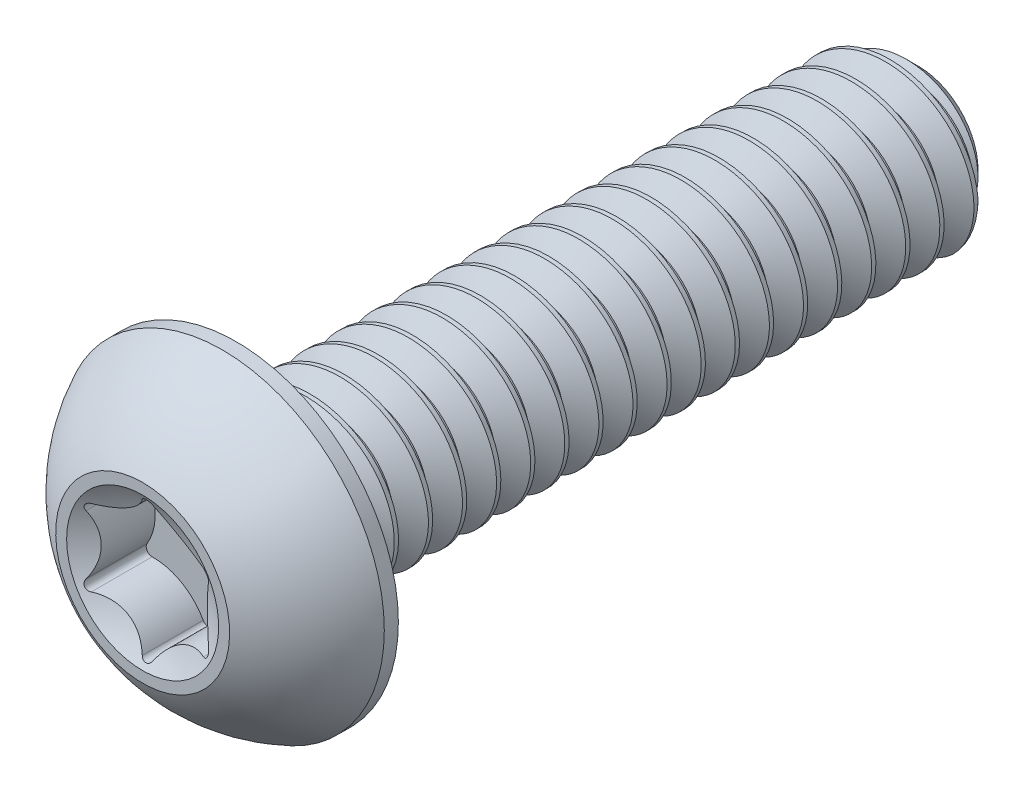
from build123d import *
from build123d.topology import SkipClean

# Parameters (mm, degrees)
CUT_EXTRUDE1_DEPTH = 0.77
CIRPATTERN1_COUNT  = 6
CUT_SWEEP1_PITCH   = 0.4
CUT_SWEEP1_TO      = 8


with BuildPart() as part:
    # Sketch2 → Revolve1 (revolve)
    with BuildSketch(Plane(origin=(0, 0, 0), x_dir=(0, 0, -1), z_dir=(1, 0, 0))):
        Polygon((1.1, 1), (8.8, 1), (9.1, 0.7), (9.1, 0), (1.1, 0), align=None)
    revolve(axis=Axis((0, 0, -9.1), (0, 0, 1)))


with BuildPart() as body_2:
    # Sketch3 → Revolve2 (revolve)
    with BuildSketch(Plane(origin=(0, 0, 0), x_dir=(0, 0, -1), z_dir=(1, 0, 0)), mode=Mode.PRIVATE) as revolve2_sk:
        with BuildLine():
            Line((1.1, 0), (1.1, 1.9))
            Line((1.1, 1.9), (0.935, 1.9))
            ThreePointArc((0.935, 1.9), (0.398804, 1.533165), (0, 1.0203))
            Line((0, 1.0203), (0, 0))
            Line((0, 0), (1.1, 0))
        make_face()
    revolve(revolve2_sk.sketch.rotate(Axis((0, 0, 0), (0, 0, -1)), 90), axis=Axis((0, 0, 0), (0, 0, -1)))

    # Combine1: union part
    add(part.part)

    # Sketch4 → Cut-Extrude1 (cut)
    with BuildSketch(Plane.XY):
        with BuildLine():
            Line((0, 0), (-0.719061, 0.41515))
            ThreePointArc((-0.719061, 0.41515), (-0.728207, 0.38044), (-0.718486, 0.345886))
            ThreePointArc((-0.718486, 0.345886), (-0.622725, 0), (-0.718486, -0.345886))
            ThreePointArc((-0.718486, -0.345886), (-0.728207, -0.38044), (-0.719061, -0.41515))
            Line((-0.719061, -0.41515), (0, 0))
        make_face()
    cut_extrude1 = extrude(amount=-CUT_EXTRUDE1_DEPTH, mode=Mode.SUBTRACT)

    # CirPattern1: Cut-Extrude1 ×6 about axis
    cirpattern1_axis = Axis((0, 0, 0), (0, 0, 1))
    for i in range(1, CIRPATTERN1_COUNT):
        add(cut_extrude1.rotate(cirpattern1_axis, i * 360 / CIRPATTERN1_COUNT), mode=Mode.SUBTRACT)

    # Sketch5 → Cut-Revolve1 (revolve, cut)
    with SkipClean():  # the faces are left unmerged after this step: merging them gives an invalid solid
        with BuildSketch(Plane(origin=(0, 0, 0), x_dir=(0, 0, -1), z_dir=(1, 0, 0))):
            with BuildLine():
                Line((-1.421546, 1.678212), (-1.421546, -1.678212))
                ThreePointArc((-1.421546, -1.678212), (0.256667, 0), (-1.421546, 1.678212))
            make_face()
        revolve(axis=Axis((0, 1.678212, 1.421546), (0, -1, 0)), mode=Mode.SUBTRACT)


with BuildPart() as body_2_2:
    # Split1: read off the stored shape, not the designer's step
    # Split1: the piece on the far side of the plane
    add(body_2.part)
    split(bisect_by=Plane.XY.offset(-1.1), keep=Keep.BOTTOM)

    # Cut-Sweep1: arcs per turn and ends read off the stored shape
    # Cut-Sweep1: the profile of Sketch7 screwed along a right-hand helix through 21 turns, 6 arcs to a turn; built about Z, then put on its axis
    cut_sweep1_z = Axis((0, 0, 0), (0, 0, 1))
    cut_sweep1_corners = [(1.021651, 0, 0.0125), (1.021651, 0, -0.3625), (0.740192, 0, -0.2), (0.740192, 0, -0.15)]
    with BuildLine(mode=Mode.PRIVATE) as cut_sweep1_profile:
        Line(cut_sweep1_corners[0], cut_sweep1_corners[1])
        Line(cut_sweep1_corners[1], cut_sweep1_corners[2])
        Line(cut_sweep1_corners[2], cut_sweep1_corners[3])
        Line(cut_sweep1_corners[3], cut_sweep1_corners[0])
    cut_sweep1_cap = Face(cut_sweep1_profile.wire())
    cut_sweep1_turn_angles = [0, 30, 60, 90, 120, 150, 180, 210, 240, 270, 300, 330, 360]
    cut_sweep1_turn_weights = [1, 0.8660254037844387, 1, 0.8660254037844387, 1, 0.8660254037844387, 1, 0.8660254037844387, 1, 0.8660254037844387, 1, 0.8660254037844387, 1]
    cut_sweep1_turn_rails = [Edge.make_bspline([Vector(p[0], p[1], 0).rotate(cut_sweep1_z, cut_sweep1_turn_angles[k]) / cut_sweep1_turn_weights[k] + Vector(0, 0, p[2] + CUT_SWEEP1_PITCH * cut_sweep1_turn_angles[k] / 360) for k in range(13)], [0, 0, 0, 1, 1, 2, 2, 3, 3, 4, 4, 5, 5, 6, 6, 6], 2, cut_sweep1_turn_weights) for p in cut_sweep1_corners]
    cut_sweep1_turn_sides = [Face.make_surface_from_curves(cut_sweep1_turn_rails[p[0]], cut_sweep1_turn_rails[p[1]]) for p in [(0, 1), (1, 2), (2, 3), (3, 0)]]
    cut_sweep1 = Plane(origin=(0, 0, -9.1), x_dir=(0, 1, 0), z_dir=(0, 0, 1)) * split(Solid(Shell([*[p.moved(Location((0, 0, CUT_SWEEP1_PITCH * i))) for i in range(21) for p in cut_sweep1_turn_sides], cut_sweep1_cap, cut_sweep1_cap.rotate(cut_sweep1_z, 7560).moved(Location((0, 0, CUT_SWEEP1_PITCH * 7560 / 360)))])), bisect_by=Plane.XY.offset(CUT_SWEEP1_TO), keep=Keep.BOTTOM, mode=Mode.PRIVATE)
    add(cut_sweep1, mode=Mode.SUBTRACT)


with BuildPart() as body_2_1:
    add(body_2.part)

    # Split1
    split(bisect_by=Plane.XY.offset(-1.1), keep=Keep.TOP)

    with SkipClean():  # the faces are left unmerged after this step: merging them gives an invalid solid
        add(body_2_2.part)  # Boss-Extrude1 merges body 2 2
        # Boss-Extrude1 cone 1 section (through the dimple's axis) → Boss-Extrude1 (revolve)
        with BuildSketch(Plane(origin=(0, 0, -1.1), x_dir=(0, -1, 0), z_dir=(1, 0, 0))):
            Polygon((0, 0), (1.0508, 0), (0, 2.887049), align=None)
        revolve(axis=Axis((0, 0, -1.1), (0, 0, -1)))


solid = body_2_1.part
